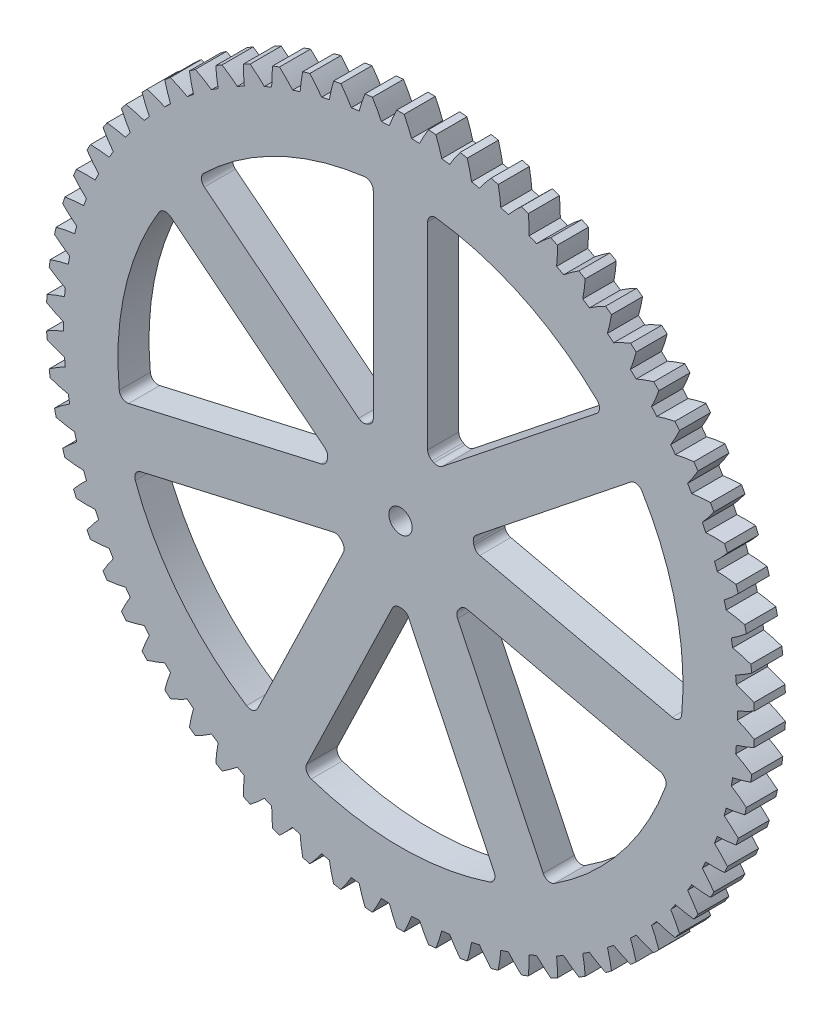
from build123d import *
from build123d.topology import SkipClean

# Parameters (mm, degrees)
SKETCH5_R            = 43.363384066
SKETCH5_R_2          = 1.5
EXTRUDE_BODY_DEPTH   = 2
EXTRUDE_TOOTH_DEPTH  = 2
CIRPATTERN1_COUNT    = 70
CUT_SPOKE_DEPTH      = 65.448211941
PATTERN_SPOKES_COUNT = 7


with BuildPart() as part:
    # Sketch5 → Extrude Body (new, symmetric)
    with BuildSketch(Plane.XY):
        Circle(SKETCH5_R)
        Circle(SKETCH5_R_2, mode=Mode.SUBTRACT)
    extrude(amount=EXTRUDE_BODY_DEPTH, both=True)

    # Sketch6 → Extrude Tooth (add, symmetric)
    with BuildSketch(Plane.XY):
        with BuildLine():
            Line((2.071701892, 40.334973226), (0.076942208, 1.498025332))
            ThreePointArc((0.076942208, 1.498025332), (0, 1.5), (-0.076942208, 1.498025332))
            Line((-0.076942208, 1.498025332), (-2.071701892, 40.334973226))
            add(Edge.make_bspline(
                [(-2.071701892, 40.334973226), (-2.072503051, 40.794325814), (-1.785153983, 42.615948017), (-1.09151265, 44.334261388), (-0.47232158, 45.560935897)],
                knots=[0, 0, 0, 0, 0.250013533, 1, 1, 1, 1], degree=3))
            ThreePointArc((-0.47232158, 45.560935897), (0, 45.563384066), (0.47232158, 45.560935897))
            add(Edge.make_bspline(
                [(2.071701892, 40.334973226), (2.072503051, 40.794325814), (1.785153983, 42.615948017), (1.09151265, 44.334261388), (0.47232158, 45.560935897)],
                knots=[0, 0, 0, 0, 0.250013533, 1, 1, 1, 1], degree=3))
        make_face()
    extrude_tooth = extrude(amount=EXTRUDE_TOOTH_DEPTH, both=True)

    # CirPattern1: Extrude Tooth ×70 about axis
    with SkipClean():  # the faces are left unmerged after this step: merging them gives an invalid solid
        cirpattern1_axis = Axis((0, 0, 2), (0, 0, -1))
        for i in range(1, CIRPATTERN1_COUNT):
            add(extrude_tooth.rotate(cirpattern1_axis, i * 360 / CIRPATTERN1_COUNT))

    # Sketch8 → Cut Spoke (cut, symmetric)
    with SkipClean():  # the faces are left unmerged after this step: merging them gives an invalid solid
        with BuildSketch(Plane.XY):
            with BuildLine():
                Line((3.5, 35.075902449), (3.5, 9.670976051))
                ThreePointArc((3.5, 9.670976051), (3.656828902, 9.133330722), (4.078125, 8.764322046))
                ThreePointArc((4.078125, 8.764322046), (4.194209478, 8.709365723), (4.30955355, 8.65287193))
                ThreePointArc((4.30955355, 8.65287193), (4.86072997, 8.553562524), (5.378859236, 8.76616513))
                Line((5.378859236, 8.76616513), (25.241230504, 24.605877656))
                ThreePointArc((25.241230504, 24.605877656), (25.616569572, 25.339326403), (25.313877154, 26.105618632))
                ThreePointArc((25.313877154, 26.105618632), (15.777481045, 32.762276975), (4.627250265, 36.06777309))
                ThreePointArc((4.627250265, 36.06777309), (3.83941324, 35.826652162), (3.5, 35.075902449))
            make_face()
        cut_spoke = extrude(amount=CUT_SPOKE_DEPTH, both=True, mode=Mode.SUBTRACT)

    # Pattern Spokes: Cut Spoke ×7 about axis
    with SkipClean():  # the faces are left unmerged after this step: merging them gives an invalid solid
        pattern_spokes_axis = Axis((0, 0, 0), (0, 0, 1))
        for i in range(1, PATTERN_SPOKES_COUNT):
            add(cut_spoke.rotate(pattern_spokes_axis, i * 360 / PATTERN_SPOKES_COUNT), mode=Mode.SUBTRACT)


solid = part.part
